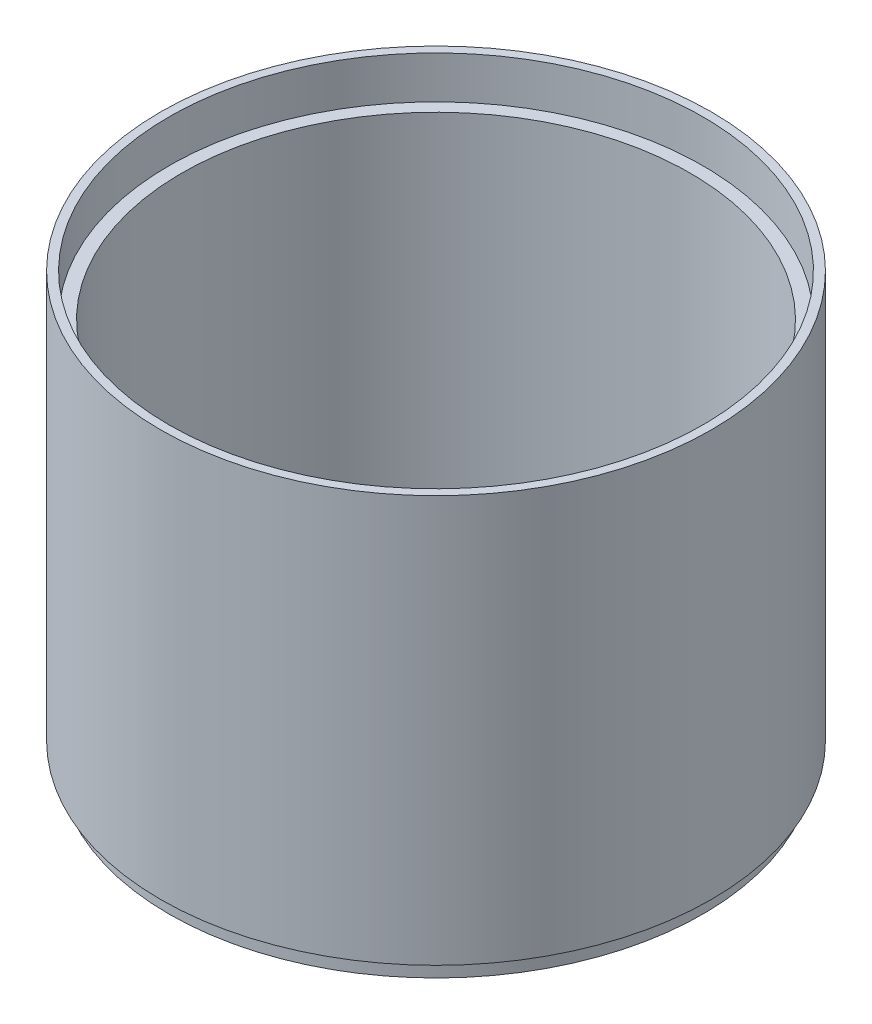
from build123d import *


with BuildPart() as part:
    # Szkic1 → Obrót1 (revolve)
    with BuildSketch(Plane.XY):
        Polygon((-63, 4), (-63, 0), (-60, 0), (-60, 90), (-63, 90), (-63, 100), (-65, 100), (-65, 28.561789866), (-65, 4), align=None)
    revolve(axis=Axis((0, 35.541039942, 0), (0, -1, 0)))


solid = part.part
